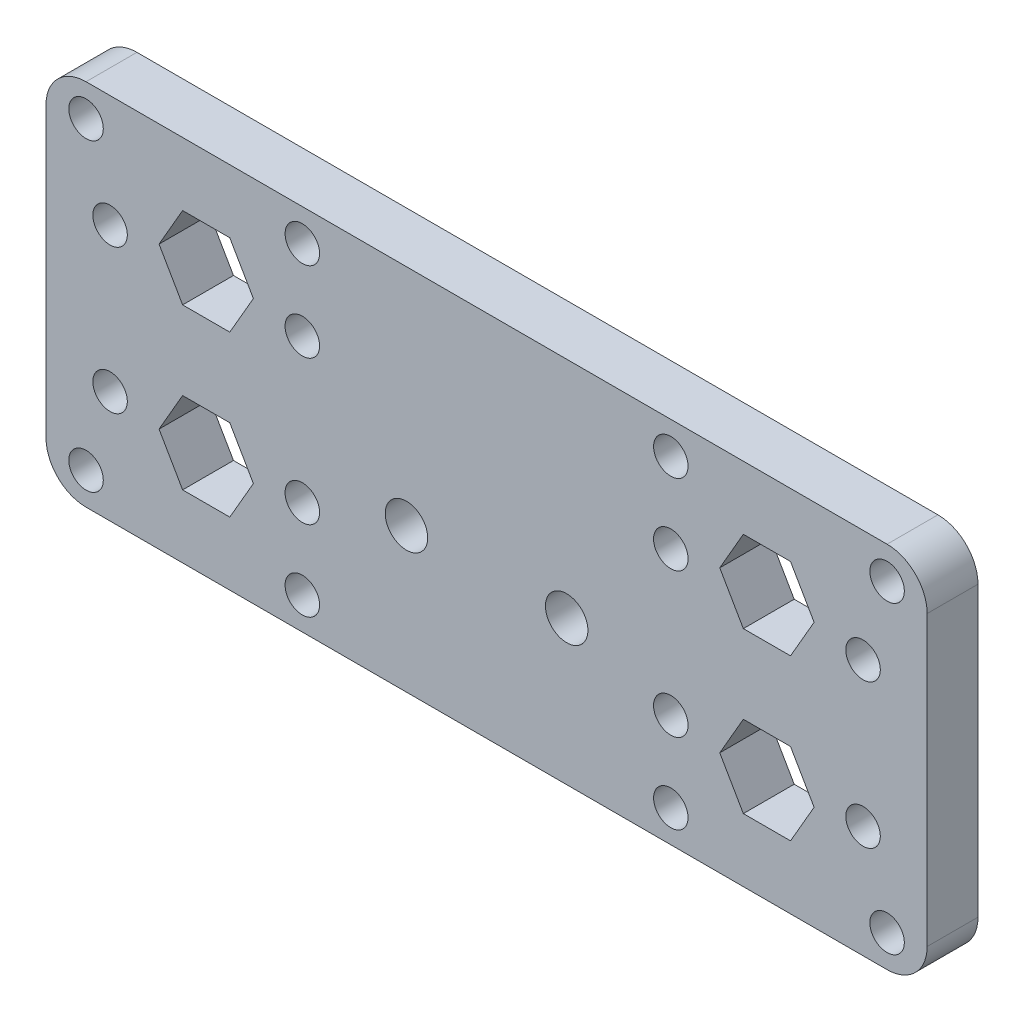
from build123d import *

# Parameters (mm, degrees)
SKETCH1_W             = 110
SKETCH1_H             = 46
BOSS_EXTRUDE1_DEPTH   = 6.35
CUT_EXTRUDE1_DEPTH    = 60.952668831
F_8_CLEARANCE_HOLE2_D = 4.3053
FILLET1_R             = 5
M5_CLEARANCE_HOLE1_D  = 5.3
F_8_CLEARANCE_HOLE1_D = 4.3053


with BuildPart() as part:
    # Sketch1 → Boss-Extrude1 (new body)
    with BuildSketch(Plane.XY):
        Rectangle(SKETCH1_W, SKETCH1_H)
    extrude(amount=BOSS_EXTRUDE1_DEPTH)

    # Sketch2 → Cut-Extrude1 (cut, through all)
    with BuildSketch(Plane.XY.offset(6.35)):
        Polygon((-32.055513627, 15.1), (-37.944486373, 15.1), (-40.888972746, 10), (-37.944486373, 4.9), (-32.055513627, 4.9), (-29.111027254, 10), align=None)
        Polygon((37.944486373, 15.1), (32.055513627, 15.1), (29.111027254, 10), (32.055513627, 4.9), (37.944486373, 4.9), (40.888972746, 10), align=None)
        Polygon((37.944486373, -4.9), (32.055513627, -4.9), (29.111027254, -10), (32.055513627, -15.1), (37.944486373, -15.1), (40.888972746, -10), align=None)
        Polygon((-32.055513627, -4.9), (-37.944486373, -4.9), (-40.888972746, -10), (-37.944486373, -15.1), (-32.055513627, -15.1), (-29.111027254, -10), align=None)
    extrude(amount=-CUT_EXTRUDE1_DEPTH, mode=Mode.SUBTRACT)

    # #8 Clearance Hole2 (through all)
    with Locations(Plane(origin=(0, 0, 0), x_dir=(-1, 0, 0), z_dir=(0, 0, -1))):
        with Locations((-47, 9), (-23, 9), (-23, -9), (-47, -9), (23, -9), (23, 9), (47, 9), (47, -9)):
            Hole(F_8_CLEARANCE_HOLE2_D / 2)

    # Fillet1
    fillet1_edges = [part.edges().sort_by_distance(p)[0] for p in [
        (-55, 23, 3.175),
        (-55, -23, 3.175),
        (55, -23, 3.175),
        (55, 23, 3.175),
    ]]
    fillet(fillet1_edges, radius=FILLET1_R)

    # M5 Clearance Hole1 (through all)
    with Locations(Plane.XY.offset(6.35)):
        with Locations((-10, -5), (10, -5)):
            Hole(M5_CLEARANCE_HOLE1_D / 2)

    # #8 Clearance Hole1 (through all)
    with Locations(Plane.XY.offset(6.35)):
        with Locations((-23, 19), (-23, -19), (23, -19), (23, 19), (-50, 19), (-50, -19), (50, -19), (50, 19)):
            Hole(F_8_CLEARANCE_HOLE1_D / 2)


solid = part.part
